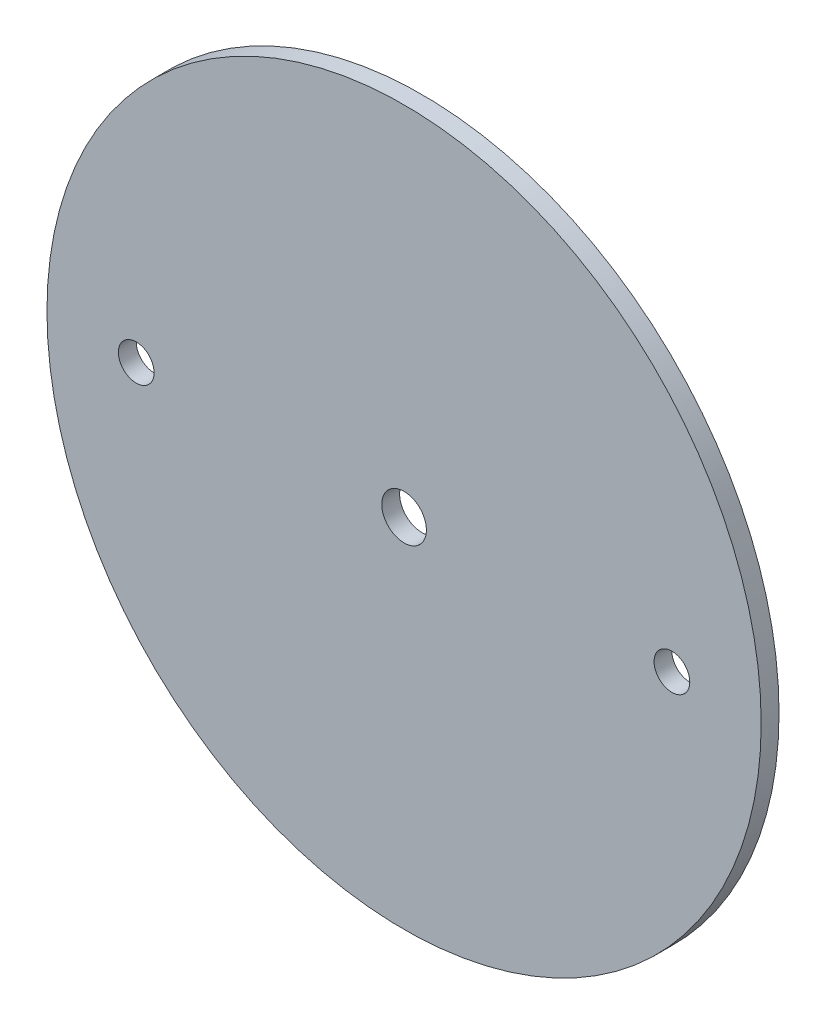
from build123d import *

# Parameters (mm, degrees)
SKETCH1_R                          = 63.5
BOSS_EXTRUDE1_DEPTH                = 1.5875
F_1_4_0_25_DIAMETER_HOLE1_D        = 6.35
F_5_16_0_3125_DIAMETER_HOLE1_D     = 7.9375
F_5_16_0_3125_DIAMETER_HOLE1_DEPTH = 3.302


with BuildPart() as part:
    # Sketch1 → Boss-Extrude1 (new, symmetric)
    with BuildSketch(Plane.XY):
        Circle(SKETCH1_R)
    extrude(amount=BOSS_EXTRUDE1_DEPTH, both=True)

    # 1/4 (0.25) Diameter Hole1 (through all)
    with Locations(Plane.XY.offset(1.5875)):
        with Locations((-47.625, 0), (47.625, 0)):
            Hole(F_1_4_0_25_DIAMETER_HOLE1_D / 2)

    # 5/16 (0.3125) Diameter Hole1
    with Locations(Plane.XY.offset(1.5875)):
        with Locations((0, 0)):
            Hole(F_5_16_0_3125_DIAMETER_HOLE1_D / 2, depth=F_5_16_0_3125_DIAMETER_HOLE1_DEPTH)


solid = part.part
